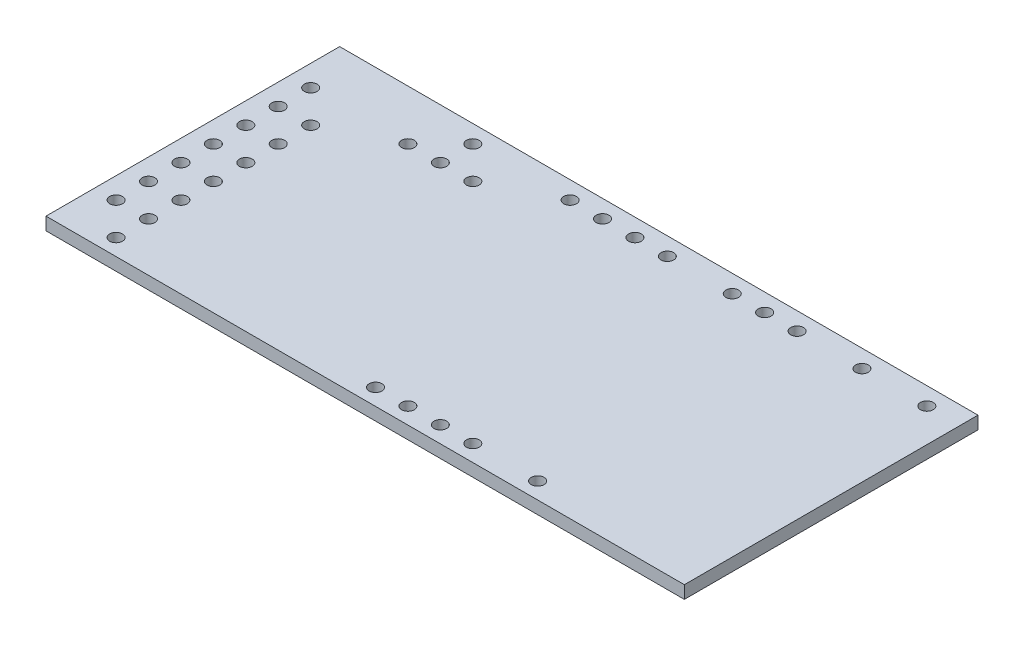
from build123d import *

# Parameters (mm, degrees)
SKETCH1_W           = 50
SKETCH1_H           = 23
BOSS_EXTRUDE1_DEPTH = 1
SKETCH2_R           = 0.5
CUT_EXTRUDE1_DEPTH  = 56.045435778


with BuildPart() as part:
    # Sketch1 → Boss-Extrude1 (new body)
    with BuildSketch(Plane(origin=(0, 0, 0), x_dir=(1, 0, 0), z_dir=(0, 1, 0))):
        with Locations((25, 11.5)):
            Rectangle(SKETCH1_W, SKETCH1_H)
    extrude(amount=BOSS_EXTRUDE1_DEPTH)

    # Sketch2 → Cut-Extrude1 (cut, through all)
    with BuildSketch(Plane(origin=(0, 1, 0), x_dir=(1, 0, 0), z_dir=(0, 1, 0))):
        with Locations((1.66, 3.83)):
            Circle(SKETCH2_R)
        with Locations((4.2, 3.83)):
            Circle(SKETCH2_R)
        with Locations((1.66, 6.37)):
            Circle(SKETCH2_R)
        with Locations((1.66, 8.91)):
            Circle(SKETCH2_R)
        with Locations((1.66, 11.45)):
            Circle(SKETCH2_R)
        with Locations((1.66, 13.99)):
            Circle(SKETCH2_R)
        with Locations((1.66, 16.53)):
            Circle(SKETCH2_R)
        with Locations((1.66, 19.07)):
            Circle(SKETCH2_R)
        with Locations((4.2, 6.37)):
            Circle(SKETCH2_R)
        with Locations((4.2, 8.91)):
            Circle(SKETCH2_R)
        with Locations((4.2, 11.45)):
            Circle(SKETCH2_R)
        with Locations((4.2, 13.99)):
            Circle(SKETCH2_R)
        with Locations((4.2, 16.53)):
            Circle(SKETCH2_R)
        with Locations((4.2, 1.29)):
            Circle(SKETCH2_R)
        with Locations((9.28, 19.07)):
            Circle(SKETCH2_R)
        with Locations((11.82, 19.07)):
            Circle(SKETCH2_R)
        with Locations((14.36, 19.07)):
            Circle(SKETCH2_R)
        with Locations((11.82, 21.61)):
            Circle(SKETCH2_R)
        with Locations((19.44, 21.61)):
            Circle(SKETCH2_R)
        with Locations((21.98, 21.61)):
            Circle(SKETCH2_R)
        with Locations((24.52, 21.61)):
            Circle(SKETCH2_R)
        with Locations((27.06, 21.61)):
            Circle(SKETCH2_R)
        with Locations((32.14, 21.61)):
            Circle(SKETCH2_R)
        with Locations((34.68, 21.61)):
            Circle(SKETCH2_R)
        with Locations((37.22, 21.61)):
            Circle(SKETCH2_R)
        with Locations((42.3, 21.61)):
            Circle(SKETCH2_R)
        with Locations((47.38, 21.61)):
            Circle(SKETCH2_R)
        with Locations((24.52, 1.29)):
            Circle(SKETCH2_R)
        with Locations((27.06, 1.29)):
            Circle(SKETCH2_R)
        with Locations((29.6, 1.29)):
            Circle(SKETCH2_R)
        with Locations((32.14, 1.29)):
            Circle(SKETCH2_R)
        with Locations((37.22, 1.29)):
            Circle(SKETCH2_R)
    extrude(amount=-CUT_EXTRUDE1_DEPTH, mode=Mode.SUBTRACT)


solid = part.part
